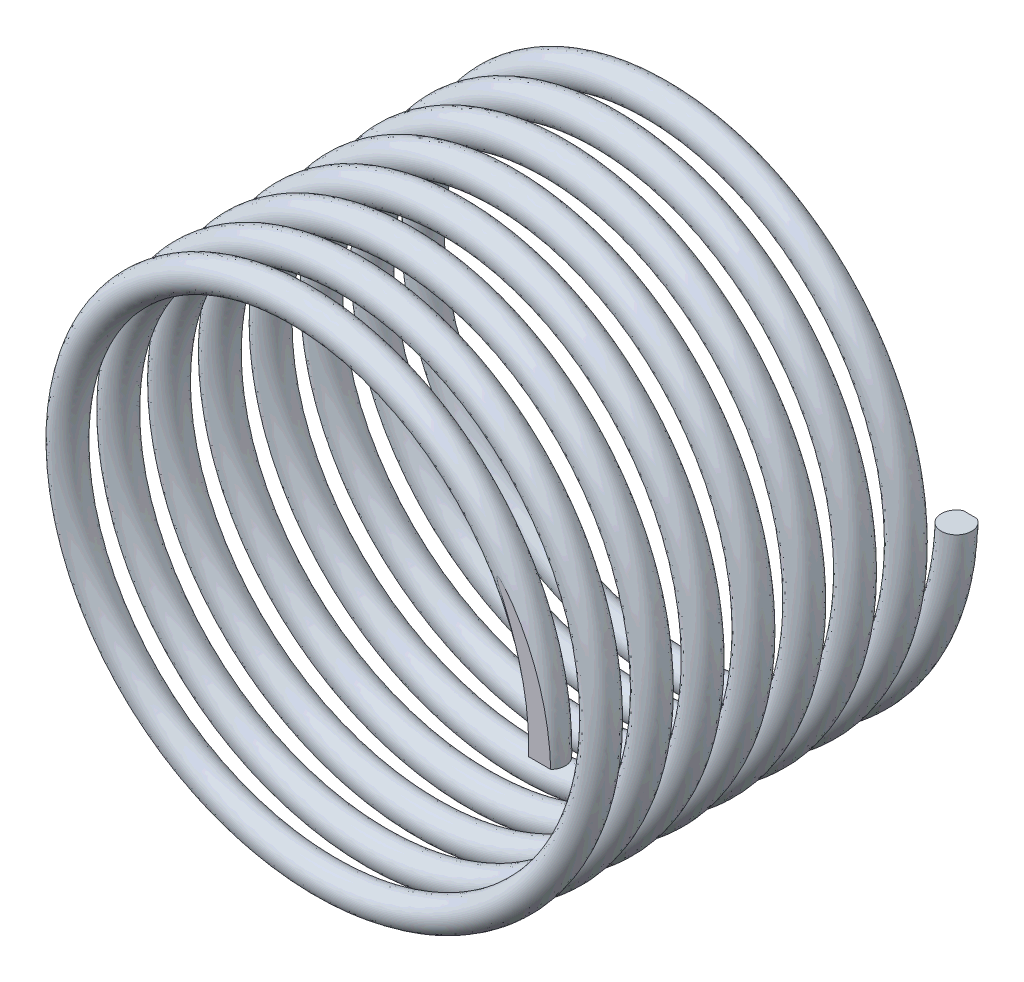
from build123d import *

# Parameters (mm, degrees)
SWEEP_1_PITCH             = 2
SWEEP_1_HEIGHT            = 16
SWEEP_1_RADIUS            = 10
SKETCH_2_R                = 0.6
CUT_EXTRUDE_START         = -3
CUT_EXTRUDE_1_OUTLINE_W   = 5
CUT_EXTRUDE_1_OUTLINE_H   = 1.462621481
CUT_EXTRUDE_1_OUTLINE_H_2 = 1.587378519
CUT_EXTRUDE_1_DEPTH       = 10


with BuildPart() as part:
    # 扫描1: sweep along a helix
    with BuildLine() as sweep_1_path:
        Helix(SWEEP_1_PITCH, SWEEP_1_HEIGHT, SWEEP_1_RADIUS, center=(0, 0, 0), direction=(0, 0, 1), lefthand=True)
    # 草图2 → 扫描1 (sweep)
    with BuildSketch(Plane(origin=(0, 0, 0), x_dir=(1, 0, 0), z_dir=(0, 1, 0))):
        with Locations((10, 0)):
            Circle(SKETCH_2_R)
    sweep(path=sweep_1_path.line, is_frenet=True)

    # 切除-拉伸1: read off the stored shape, not the designer's step
    # 切除-拉伸1 outline → 切除-拉伸1 (cut)
    with BuildSketch(Plane(origin=(0, 0, 0), x_dir=(1, 0, 0), z_dir=(0, 1, 0)).offset(CUT_EXTRUDE_START)):
        with Locations((9.5, 1.268689259)):
            Rectangle(CUT_EXTRUDE_1_OUTLINE_W, CUT_EXTRUDE_1_OUTLINE_H)
        with Locations((9.5, -17.206310741)):
            Rectangle(CUT_EXTRUDE_1_OUTLINE_W, CUT_EXTRUDE_1_OUTLINE_H_2)
    extrude(amount=CUT_EXTRUDE_1_DEPTH, mode=Mode.SUBTRACT)


solid = part.part
